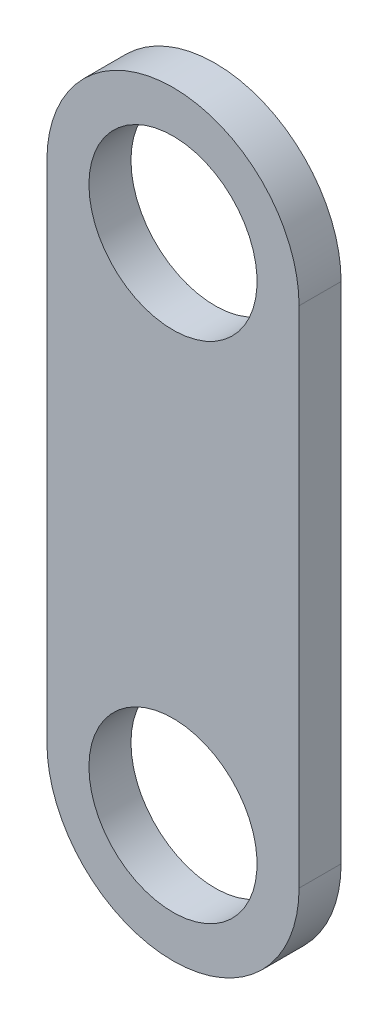
from build123d import *

# Parameters (mm, degrees)
BOSS_EXTRUDE2_DEPTH = 6.35
SKETCH2_R           = 12.7
CUT_EXTRUDE1_DEPTH  = 74.656890292


with BuildPart() as part:
    # Sketch1 → Boss-Extrude2 (new body)
    with BuildSketch(Plane.XY):
        with BuildLine():
            Line((-29.739928058, 28.163848921), (-29.739928058, -48.036151079))
            ThreePointArc((-29.739928058, -48.036151079), (-10.689928058, -67.086151079), (8.360071942, -48.036151079))
            Line((8.360071942, -48.036151079), (8.360071942, 28.163848921))
            ThreePointArc((8.360071942, 28.163848921), (-10.689928058, 47.213848921), (-29.739928058, 28.163848921))
        make_face()
    extrude(amount=BOSS_EXTRUDE2_DEPTH)

    # Sketch2 → Cut-Extrude1 (cut, through all)
    with BuildSketch(Plane(origin=(0, 0, 0), x_dir=(-1, 0, 0), z_dir=(0, 0, -1))):
        with Locations((10.689928058, 28.163848921)):
            Circle(SKETCH2_R)
        with Locations((10.689928058, -48.036151079)):
            Circle(SKETCH2_R)
    extrude(amount=-CUT_EXTRUDE1_DEPTH, mode=Mode.SUBTRACT)


solid = part.part
